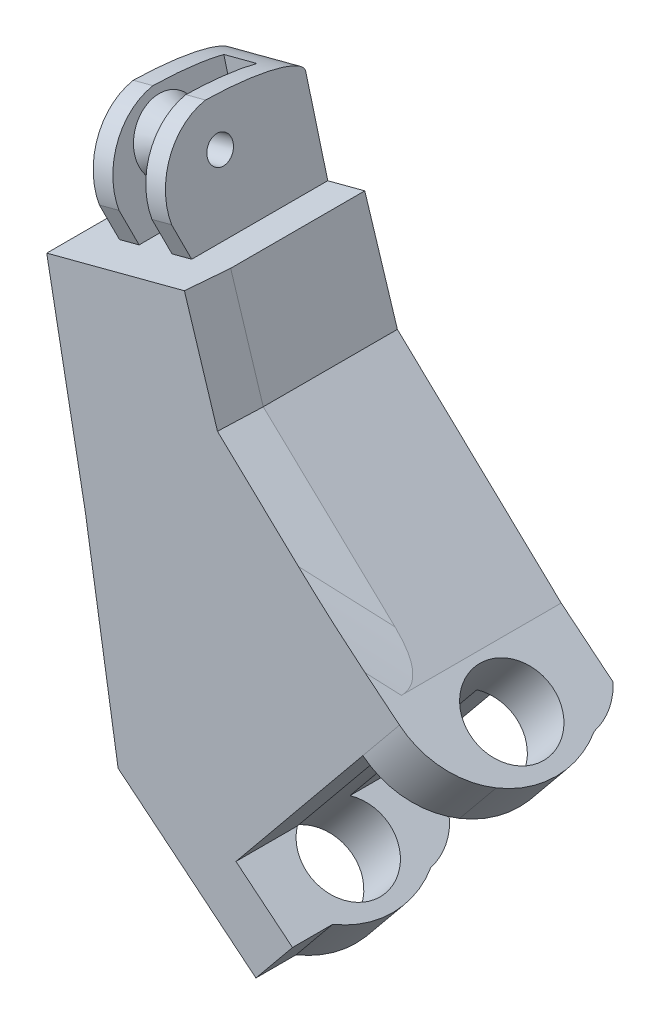
from build123d import *

# Parameters (mm, degrees)
BOSS_EXTRUDE1_DEPTH           = 17
CUT_EXTRUDE1_DEPTH            = 17
SKETCH3_R                     = 1.25
CUT_EXTRUDE2_DEPTH            = 17
CUT_EXTRUDE3_START            = -10.402815
SKETCH4_W                     = 3.3
SKETCH4_H                     = 12.499682623
CUT_EXTRUDE3_DEPTH            = 10.402815
SKETCH5_R                     = 2.25
SKETCH5_R_2                   = 1.25
EXTRUDE_THIN1_DEPTH           = 1.65
EXTRUDE_THIN1_TAPER           = -30
EXTRUDE_THIN1_OTHER_WAY_DEPTH = 1.65
EXTRUDE_THIN1_OTHER_WAY_TAPER = -30
SKETCH6_R                     = 1.25
CUT_EXTRUDE4_DEPTH            = 58.713758796
CUT_EXTRUDE5_DEPTH            = 47
CUT_EXTRUDE6_DEPTH            = 51
SKETCH9_R                     = 4
CUT_EXTRUDE7_DEPTH            = 51
CHAMFER2_SIZE                 = 4
CHAMFER2_SIZE_2               = 0.5
FILLET3_R                     = 30
FILLET4_SIZE                  = 2
FILLET4_SIZE_2                = 10


with BuildPart() as part:
    # Sketch1 → Boss-Extrude1 (new body)
    with BuildSketch(Plane.XY):
        Polygon((0, 0), (-3.159113316, 10.05), (-6.746853749, 9.105426772), (-9.395430715, 19.165426772), (-16.396843313, 17.322108667), (-13.748266347, 7.262108667), (-16.987870242, 6.409192141), (-13.249821349, -13.430807859), (-10.069194805, -33.377281726), (4.664340434, -45.432247006), (8.210516928, -41.098122841), (1.353313338, -35.487565032), (13.657279278, -20.449702081), (20.514482868, -26.06025989), (24.060659362, -21.726135725), (15.88, -15.032727593), align=None)
    extrude(amount=BOSS_EXTRUDE1_DEPTH)

    # Sketch2 → Cut-Extrude1 (cut)
    with BuildSketch(Plane(origin=(-11.069057434, -2.914239618, 0), x_dir=(0, 0, 1), z_dir=(-0.9670459389139427, -0.2546019482055291, 0))):
        with BuildLine():
            Line((14.33099337, 13.694095472), (13.19, 10.523128091))
            Line((13.19, 10.523128091), (20.415721384, 10.523128091))
            Line((20.415721384, 10.523128091), (20.415721384, 21.928823046))
            Line((20.415721384, 21.928823046), (-2.093019815, 21.928823046))
            Line((-2.093019815, 21.928823046), (-2.093019815, 20.981086575))
            Line((-2.093019815, 20.981086575), (9.161350785, 20.925943092))
            ThreePointArc((9.161350785, 20.925943092), (13.295140538, 18.417290029), (14.33099337, 13.694095472))
        make_face()
    extrude(amount=-CUT_EXTRUDE1_DEPTH, mode=Mode.SUBTRACT)

    # Sketch3 → Cut-Extrude2 (cut)
    with BuildSketch(Plane(origin=(-11.069057434, -2.914239618, 0), x_dir=(0, 0, 1), z_dir=(-0.9670459389139427, -0.2546019482055291, 0))):
        with Locations(Location((8.8, 16.925943092, 0), (0, 0, 270))):
            Circle(SKETCH3_R)
    extrude(amount=-CUT_EXTRUDE2_DEPTH, mode=Mode.SUBTRACT)

    # Sketch4 → Cut-Extrude3 (cut)
    with BuildSketch(Plane(origin=(-5.327785879, 20.236348285, 0), x_dir=(0.9670459389139427, 0.2546019482055291, 0), z_dir=(-0.2546019482055291, 0.9670459389139427, 0)).offset(CUT_EXTRUDE3_START)):
        with Locations((-7.826258123, -8.749841312)):
            Rectangle(SKETCH4_W, SKETCH4_H)
    extrude(amount=CUT_EXTRUDE3_DEPTH, mode=Mode.SUBTRACT)

    # Sketch5 → Extrude-Thin1 (add)
    with BuildSketch(Plane(origin=(-7.568351135, -1.992580565, 0), x_dir=(0, 0, 1), z_dir=(-0.9670459389139427, -0.25460194820552917, 0))):
        with Locations((8.8, 16.925943092)):
            Circle(SKETCH5_R)
        with Locations((8.8, 16.925943092)):
            Circle(SKETCH5_R_2, mode=Mode.SUBTRACT)
    extrude(amount=EXTRUDE_THIN1_DEPTH, taper=EXTRUDE_THIN1_TAPER)

    # Sketch5 → Extrude-Thin1 other way (add)
    with BuildSketch(Plane(origin=(-7.568351135, -1.992580565, 0), x_dir=(0, 0, 1), z_dir=(-0.9670459389139427, -0.25460194820552917, 0))):
        with Locations((8.8, 16.925943092)):
            Circle(SKETCH5_R)
        with Locations((8.8, 16.925943092)):
            Circle(SKETCH5_R_2, mode=Mode.SUBTRACT)
    extrude(amount=-EXTRUDE_THIN1_OTHER_WAY_DEPTH, taper=EXTRUDE_THIN1_OTHER_WAY_TAPER)

    # Sketch6 → Cut-Extrude4 (cut, through all)
    with BuildSketch(Plane(origin=(-11.069057434, -2.914239618, 0), x_dir=(0, 0, 1), z_dir=(-0.9670459389139427, -0.2546019482055291, 0))):
        with Locations(Location((8.8, 16.925943092, 0), (0, 0, 270))):
            Circle(SKETCH6_R)
    extrude(amount=-CUT_EXTRUDE4_DEPTH, mode=Mode.SUBTRACT)

    # Sketch7 → Cut-Extrude5 (cut)
    with BuildSketch(Plane(origin=(-20.395990741, -24.927906579, 0), x_dir=(-0.773950743756153, 0.633245802385849, 0), z_dir=(-0.6332458023858489, -0.7739507437561529, 0))):
        with BuildLine():
            add(Edge.make_bspline(
                [(-28.329749458, 0), (-30.166192179, -1.367621789), (-30.599748983, -3.6)],
                knots=[0, 0, 0, 1, 1, 1], degree=2))
            Line((-28.329749458, 0), (-32.379749458, 0))
            Line((-32.379749458, 0), (-32.379749458, -17))
            Line((-32.379749458, -17), (-30.599749458, -17))
            Line((-30.599749458, -17), (-30.599749458, -13.1))
            ThreePointArc((-30.599749458, -13.1), (-31.973295872, -8.349999931), (-30.599748983, -3.6))
        make_face()
    extrude(amount=-CUT_EXTRUDE5_DEPTH, mode=Mode.SUBTRACT)

    # Sketch8 → Cut-Extrude6 (cut)
    with BuildSketch(Plane(origin=(-4.545848307, -5.555919463, 0), x_dir=(0.7739507437561534, -0.6332458023858486, 0), z_dir=(-0.6332458023858486, -0.7739507437561534, 0))):
        with BuildLine():
            Line((30.599749458, 13.1), (30.599749458, 17))
            Line((30.599749458, 17), (23.519749458, 17))
            ThreePointArc((23.519749458, 17), (27.561296191, 15.960500224), (30.599749458, 13.1))
        make_face()
    extrude(amount=-CUT_EXTRUDE6_DEPTH, mode=Mode.SUBTRACT)

    # Sketch9 → Cut-Extrude7 (cut)
    with BuildSketch(Plane(origin=(-20.395990741, -24.927906579, 0), x_dir=(-0.773950743756153, 0.633245802385849, 0), z_dir=(-0.6332458023858489, -0.7739507437561529, 0))):
        with Locations(Location((-26.599749458, -8.5, 0), (0, 0, 180))):
            Circle(SKETCH9_R)
    extrude(amount=-CUT_EXTRUDE7_DEPTH, mode=Mode.SUBTRACT)

    # Chamfer2
    # the kernel refuses this chamfer: 4, 0.5 mm, written as the material it takes off along each edge
    with BuildSketch(Plane(origin=(23.430476857, -22.180351132, 17), x_dir=(0.003280548241470475, 0.003465446024389789, -0.9999886142787264), z_dir=(-0.7262148132107521, 0.6874678502106645, 0))) as chamfer2_piece_1_section:
        Polygon((CHAMFER2_SIZE * 0.999988614279, CHAMFER2_SIZE * 0.00477192968437), (-CHAMFER2_SIZE_2 * 0.00477192968437, CHAMFER2_SIZE_2 * 0.999988614279), (0, 0), align=None)
    chamfer2_piece_1 = extrude(amount=42.660867212, mode=Mode.PRIVATE)
    chamfer2_piece_1 = split(chamfer2_piece_1, bisect_by=Plane(origin=(2.714923218, -8.636910301, 15.455863369), z_dir=(0.9539790028805075, 0.2998734100635013, 0)), keep=Keep.TOP, mode=Mode.PRIVATE)
    chamfer2_piece_1 = split(chamfer2_piece_1, bisect_by=Plane(origin=(6.949444097, -7.725754787, 15.455863369), z_dir=(0.6332458023858455, 0.7739507437561558, 0)), keep=Keep.TOP, mode=Mode.PRIVATE)
    add(chamfer2_piece_1, mode=Mode.SUBTRACT)
    with BuildSketch(Plane(origin=(3.117792699, -9.918547862, 17), x_dir=(0.0045523207221114005, 0.0014309748270353465, -0.9999886142787264), z_dir=(-0.2998734100635013, 0.9539790028805075, 0))) as chamfer2_piece_2_section:
        Polygon((CHAMFER2_SIZE * 0.999988614279, CHAMFER2_SIZE * 0.00477192968437), (-CHAMFER2_SIZE_2 * 0.00477192968437, CHAMFER2_SIZE_2 * 0.999988614279), (0, 0), align=None)
    chamfer2_piece_2 = extrude(amount=31.328882119, mode=Mode.PRIVATE)
    chamfer2_piece_2 = split(chamfer2_piece_2, bisect_by=Plane(origin=(-6.749370263, 6.389259735, 15.513791759), z_dir=(0.6874678502106645, 0.7262148132107521, 0)), keep=Keep.TOP, mode=Mode.PRIVATE)
    add(chamfer2_piece_2, mode=Mode.SUBTRACT)
    with BuildSketch(Plane(origin=(3.117792699, -9.918547862, 17), x_dir=(0.0045523207221114005, 0.0014309748270353465, -0.9999886142787264), z_dir=(-0.2998734100635013, 0.9539790028805075, 0))) as chamfer2_piece_3a_section:
        Polygon((CHAMFER2_SIZE * 0.999988614279, CHAMFER2_SIZE * 0.00477192968437), (-CHAMFER2_SIZE_2 * 0.00477192968437, CHAMFER2_SIZE_2 * 0.999988614279), (0, 0), align=None)
    chamfer2_piece_3a = extrude(amount=31.328882119, mode=Mode.PRIVATE)
    chamfer2_piece_3a = split(chamfer2_piece_3a, bisect_by=Plane(origin=(3.183687603, -3.013822952, 15.535130807), z_dir=(-0.6874678502106645, -0.7262148132107521, 0)), keep=Keep.TOP, mode=Mode.PRIVATE)
    with BuildSketch(Plane(origin=(23.430476857, -22.180351132, 17), x_dir=(0.003280548241470475, 0.003465446024389789, -0.9999886142787264), z_dir=(-0.7262148132107521, 0.6874678502106645, 0))) as chamfer2_piece_3b_section:
        Polygon((CHAMFER2_SIZE * 0.999988614279, CHAMFER2_SIZE * 0.00477192968437), (-CHAMFER2_SIZE_2 * 0.00477192968437, CHAMFER2_SIZE_2 * 0.999988614279), (0, 0), align=None)
    chamfer2_piece_3b = extrude(amount=42.660867212, mode=Mode.PRIVATE)
    chamfer2_piece_3b = split(chamfer2_piece_3b, bisect_by=Plane(origin=(-1.314629282, 4.18219385, 15.535130807), z_dir=(-0.9539790028805075, -0.2998734100635013, 0)), keep=Keep.TOP, mode=Mode.PRIVATE)
    chamfer2_piece_3 = chamfer2_piece_3a & chamfer2_piece_3b
    add(chamfer2_piece_3, mode=Mode.SUBTRACT)

    # Fillet3
    # the kernel refuses this fillet: 30 mm, written as the material it adds along each edge
    with BuildSketch(Plane(origin=(19.498535053, -17.993409719, 10.299717624), x_dir=(0.3870758506648627, -0.3167051128458923, 0.865950435838763), z_dir=(-0.6702029838732583, 0.5483594785692364, 0.500129825815914))) as fillet3_piece_1_section:
        with BuildLine():
            CenterArc((FILLET3_R * 0.071988838012, FILLET3_R), FILLET3_R, 261.764893066, 8.235106934)
            Line((-FILLET3_R * 0.071246536041, FILLET3_R * 0.0103113481403), (0, 0))
            Line((0, 0), (FILLET3_R * 0.071988838012, 0))
        make_face()
    fillet3_piece_1 = extrude(amount=18.796249028, mode=Mode.PRIVATE)
    fillet3_piece_1 = split(fillet3_piece_1, bisect_by=Plane(origin=(13.825719707, -13.08805278, 14.411900392), z_dir=(-0.6874678502106645, -0.7262148132107521, 0)), keep=Keep.TOP, mode=Mode.PRIVATE)
    fillet3_piece_1 = split(fillet3_piece_1, bisect_by=Plane(origin=(13.532386136, -13.397919176, 17), z_dir=(0, 0, -1)), keep=Keep.TOP, mode=Mode.PRIVATE)
    fillet3_piece_1 = fillet3_piece_1 - Plane(origin=(19.447051663, -18.23729319, 8.5), x_dir=(0.773950743756153, -0.633245802385849, 0), z_dir=(-0.633245802385849, -0.773950743756153, 0)) * Cylinder(4, 47, mode=Mode.PRIVATE)
    add(fillet3_piece_1)

    # Fillet4
    # an asymmetric fillet: 10, 2 mm, written as the material it takes off along each edge
    with BuildSketch(Plane(origin=(14.780717757, 25.530475477, 0), x_dir=(0.2546019482055286, -0.9670459389139429, 0), z_dir=(-0.9670459389139429, -0.2546019482055286, 0))) as fillet4_piece_1:
        with BuildLine():
            Bezier((FILLET4_SIZE, 0), (0, 0), (0, FILLET4_SIZE_2), weights=[1, 0.707106781, 1])
            Line((0, FILLET4_SIZE_2), (0, 0))
            Line((0, 0), (FILLET4_SIZE, 0))
        make_face()
    extrude(amount=57.24, mode=Mode.SUBTRACT)


solid = part.part
